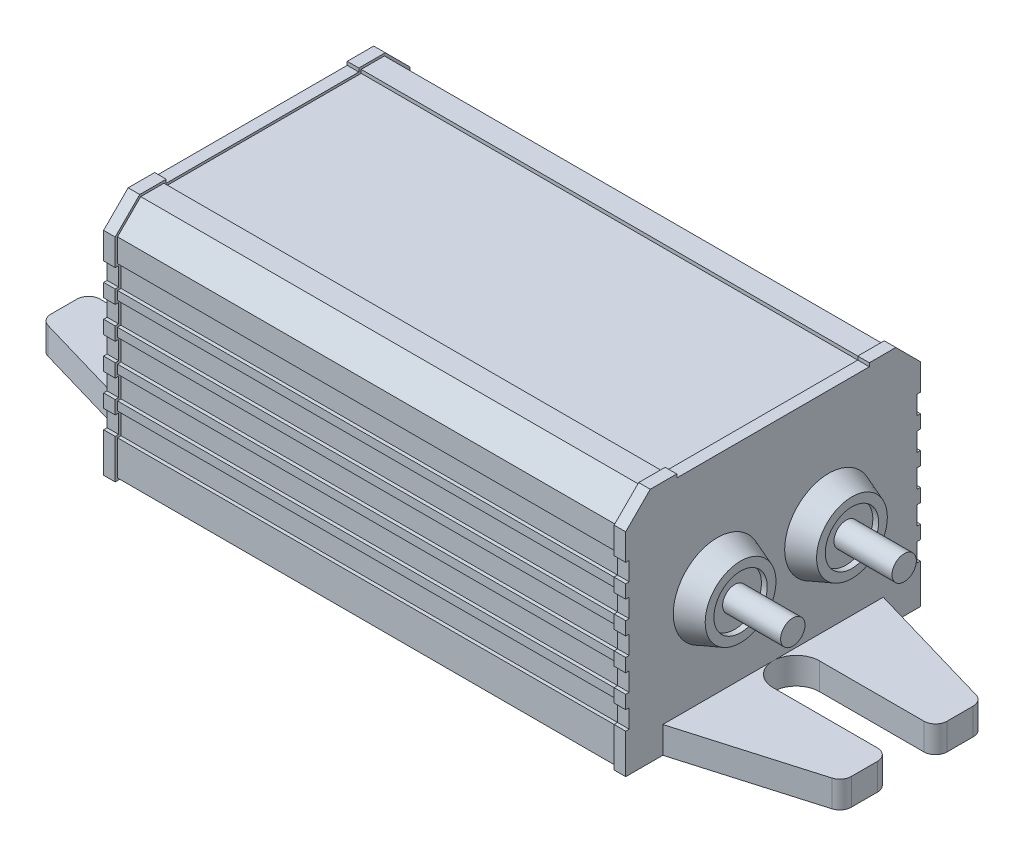
from build123d import *

# Parameters (mm, degrees)
SKETCH_1_W          = 45
SKETCH_1_H          = 25
EXTRUDE_1_DEPTH     = 20
CHAMFER_1_SIZE      = 2
SKETCH_2_W          = 17
SKETCH_2_H          = 0.3
SKETCH_2_W_2        = 0.3
SKETCH_2_H_2        = 2
CUT_EXTRUDE_1_DEPTH = 1000
EXTRUDE_1_2_DEPTH   = 1
SKETCH_4_W          = 19
SKETCH_4_H          = 2.3
EXTRUDE_2_DEPTH     = 12
CUT_EXTRUDE_2_DEPTH = 12
FILLET_1_R          = 1
SKETCH_6_R          = 3.8
EXTRUDE_3_DEPTH     = 2
CHAMFER_2_SIZE2     = 0.75
CHAMFER_2_SIZE      = 2
SKETCH_7_R          = 2.3
CUT_EXTRUDE_3_DEPTH = 0.5
SKETCH_8_R          = 1.05
EXTRUDE_4_DEPTH     = 5
FILLET_2_R          = 1


# Read off the part's stored shape, not the designer's step: ﾐﾗｰ4
with BuildPart() as part:
    # ｽｹｯﾁ1 → Extrude 1 (new body)
    with BuildSketch(Plane(origin=(0, 0, 0), x_dir=(1, 0, 0), z_dir=(0, 1, 0))):
        Rectangle(SKETCH_1_W, SKETCH_1_H)
    extrude(amount=EXTRUDE_1_DEPTH)

    # 面取り1
    chamfer_1_edges = [part.edges().sort_by_distance(p)[0] for p in [
        (0, 20, 12.5),
        (0, 20, -12.5),
    ]]
    chamfer(chamfer_1_edges, length=CHAMFER_1_SIZE)

    # ｽｹｯﾁ2 → ｶｯﾄ - 押し出し1 (cut)
    with BuildSketch(Plane.ZY.offset(22.5)):
        with Locations((0, 19.85)):
            Rectangle(SKETCH_2_W, SKETCH_2_H)
        with Locations((-12.35, 15)):
            Rectangle(SKETCH_2_W_2, SKETCH_2_H_2)
        with Locations((-12.35, 12.25)):
            Rectangle(SKETCH_2_W_2, SKETCH_2_H_2)
        with Locations((-12.35, 9.5)):
            Rectangle(SKETCH_2_W_2, SKETCH_2_H_2)
        with Locations((-12.35, 6.75)):
            Rectangle(SKETCH_2_W_2, SKETCH_2_H_2)
        with Locations((-12.35, 4)):
            Rectangle(SKETCH_2_W_2, SKETCH_2_H_2)
    cut_extrude_1 = extrude(amount=-CUT_EXTRUDE_1_DEPTH, mode=Mode.SUBTRACT)

    # ﾐﾗｰ1: ｶｯﾄ - 押し出し1 across plane
    add(cut_extrude_1.mirror(Plane.XY), mode=Mode.SUBTRACT)

    # ｽｹｯﾁ3 → Extrude 1 2 (add)
    with BuildSketch(Plane(origin=(22.5, 0, 0), x_dir=(0, 0, -1), z_dir=(1, 0, 0))):
        Polygon((-12.7, 18.082842712), (-12.7, 15.8), (-12.4, 15.8), (-12.4, 14.2), (-12.7, 14.2), (-12.7, 13.05), (-12.4, 13.05), (-12.4, 11.45), (-12.7, 11.45), (-12.7, 10.3), (-12.4, 10.3), (-12.4, 8.7), (-12.7, 8.7), (-12.7, 7.55), (-12.4, 7.55), (-12.4, 5.95), (-12.7, 5.95), (-12.7, 4.8), (-12.4, 4.8), (-12.4, 3.2), (-12.7, 3.2), (-12.7, -0.2), (12.7, -0.2), (12.7, 3.2), (12.4, 3.2), (12.4, 4.8), (12.7, 4.8), (12.7, 5.95), (12.4, 5.95), (12.4, 7.55), (12.7, 7.55), (12.7, 8.7), (12.4, 8.7), (12.4, 10.3), (12.7, 10.3), (12.7, 11.45), (12.4, 11.45), (12.4, 13.05), (12.7, 13.05), (12.7, 14.2), (12.4, 14.2), (12.4, 15.8), (12.7, 15.8), (12.7, 18.082842712), (10.582842712, 20.2), (8.3, 20.2), (8.3, 19.9), (-8.3, 19.9), (-8.3, 20.2), (-10.582842712, 20.2), align=None)
        Polygon((-12.5, 18), (-12.5, 16), (-12.2, 16), (-12.2, 14), (-12.5, 14), (-12.5, 13.25), (-12.2, 13.25), (-12.2, 11.25), (-12.5, 11.25), (-12.5, 10.5), (-12.2, 10.5), (-12.2, 8.5), (-12.5, 8.5), (-12.5, 7.75), (-12.2, 7.75), (-12.2, 5.75), (-12.5, 5.75), (-12.5, 5), (-12.2, 5), (-12.2, 3), (-12.5, 3), (-12.5, 0), (12.5, 0), (12.5, 3), (12.2, 3), (12.2, 5), (12.5, 5), (12.5, 5.75), (12.2, 5.75), (12.2, 7.75), (12.5, 7.75), (12.5, 8.5), (12.2, 8.5), (12.2, 10.5), (12.5, 10.5), (12.5, 11.25), (12.2, 11.25), (12.2, 13.25), (12.5, 13.25), (12.5, 14), (12.2, 14), (12.2, 16), (12.5, 16), (12.5, 18), (10.5, 20), (8.5, 20), (8.5, 19.7), (-8.5, 19.7), (-8.5, 20), (-10.5, 20), align=None, mode=Mode.SUBTRACT)
    extrude_1_2 = extrude(amount=-EXTRUDE_1_2_DEPTH)

    # ﾐﾗｰ2: Extrude 1 2 across plane
    add(extrude_1_2.mirror(Plane(origin=(0, 0, 0), x_dir=(0, 0, 1), z_dir=(1, 0, 0))))

    # ｽｹｯﾁ4 → ﾎﾞｽ - 押し出し2 (add)
    with BuildSketch(Plane.ZY.offset(22.5)):
        with Locations((0, 0.95)):
            Rectangle(SKETCH_4_W, SKETCH_4_H)
    extrude_2 = extrude(amount=EXTRUDE_2_DEPTH)

    # ｽｹｯﾁ5 → ｶｯﾄ - 押し出し2 (cut)
    with BuildSketch(Plane(origin=(0, 2.1, 0), x_dir=(1, 0, 0), z_dir=(0, 1, 0))):
        with BuildLine():
            Line((-24.5, 2), (-34.5, 2))
            Line((-34.5, 2), (-34.5, -2))
            Line((-34.5, -2), (-24.5, -2))
            ThreePointArc((-24.5, -2), (-22.5, 0), (-24.5, 2))
        make_face()
        Polygon((-34.5, 9.5), (-34.5, 6), (-22.5, 9.5), align=None)
        Polygon((-22.5, -9.5), (-34.5, -6), (-34.5, -9.5), align=None)
    cut_extrude_2 = extrude(amount=-CUT_EXTRUDE_2_DEPTH, mode=Mode.SUBTRACT)

    # ﾌｨﾚｯﾄ1
    fillet_1_edges = [part.edges().sort_by_distance(p)[0] for p in [
        (-22.5, 0.95, -9.5),
        (-22.5, 0.95, 9.5),
        (-34.5, 0.95, 6),
        (-34.5, 0.95, -2),
        (-34.5, 0.95, 2),
        (-34.5, 0.95, -6),
    ]]
    fillet(fillet_1_edges, radius=FILLET_1_R)

    # ﾐﾗｰ3: ﾎﾞｽ - 押し出し2, ｶｯﾄ - 押し出し2 across plane
    add(extrude_2.mirror(Plane(origin=(0, 0, 0), x_dir=(0, 0, 1), z_dir=(1, 0, 0))))
    add(cut_extrude_2.mirror(Plane(origin=(0, 0, 0), x_dir=(0, 0, 1), z_dir=(1, 0, 0))), mode=Mode.SUBTRACT)

    # ｽｹｯﾁ6 → ﾎﾞｽ - 押し出し3 (add)
    with BuildSketch(Plane.ZY.offset(22.5)):
        with Locations(Location((4.8, 9.9, 0), (0, 0, 180))):
            Circle(SKETCH_6_R)
    extrude(amount=EXTRUDE_3_DEPTH)

    # 面取り2
    chamfer_2_edges = [part.edges().sort_by_distance(p)[0] for p in [
        (-24.5, 9.9, 8.6),
    ]]
    chamfer_2_side = [part.faces().sort_by_distance(p)[0] for p in [
        (-24.485, 9.9, 8.6),
    ]]
    chamfer(chamfer_2_edges, length=CHAMFER_2_SIZE - 0.0001, length2=CHAMFER_2_SIZE2 - 0.0001, reference=chamfer_2_side[0])  # a hair under: the kernel refuses the full size

    # ｽｹｯﾁ7 → ｶｯﾄ - 押し出し3 (cut)
    with BuildSketch(Plane.ZY.offset(24.5)):
        with Locations((4.8, 9.9)):
            Circle(SKETCH_7_R)
    extrude(amount=-CUT_EXTRUDE_3_DEPTH, mode=Mode.SUBTRACT)

    # ｽｹｯﾁ8 → ﾎﾞｽ - 押し出し4 (add)
    with BuildSketch(Plane.ZY.offset(24)):
        with Locations((4.8, 9.9)):
            Circle(SKETCH_8_R)
    extrude(amount=EXTRUDE_4_DEPTH)

    # ﾐﾗｰ4 outline → ﾐﾗｰ4 (revolve)
    with BuildSketch(Plane(origin=(0, 9.9, -4.8), x_dir=(0, 1, 0), z_dir=(0, 0, -1))):
        Polygon((2.3, -24), (2.3, -24.5), (3.05, -24.5), (3.8, -22.5), (0, -22.5), (0, -29), (1.05, -29), (1.05, -24), align=None)
        Polygon((3.8, 22.5), (3.05, 24.5), (2.3, 24.5), (2.3, 24), (1.05, 24), (1.05, 29), (0, 29), (0, 22.5), align=None)
    revolve(axis=Axis((0, 9.9, -4.8), (1, 0, 0)))

    # Mirror 4 2 outline → Mirror 4 2 (revolve)
    with BuildSketch(Plane(origin=(0, 9.9, 4.8), x_dir=(0, 1, 0), z_dir=(0, 0, -1))):
        Polygon((3.8, 22.5), (3.05, 24.5), (2.3, 24.5), (2.3, 24), (1.05, 24), (1.05, 29), (0, 29), (0, 22.5), align=None)
    revolve(axis=Axis((0, 9.9, 4.8), (1, 0, 0)))

    # ﾌｨﾚｯﾄ2
    fillet_2_edges = [part.edges().sort_by_distance(p)[0] for p in [
        (34.5, 0.95, 6),
        (34.5, 0.95, -2),
        (34.5, 0.95, 2),
        (34.5, 0.95, -6),
    ]]
    fillet(fillet_2_edges, radius=FILLET_2_R)


solid = part.part
